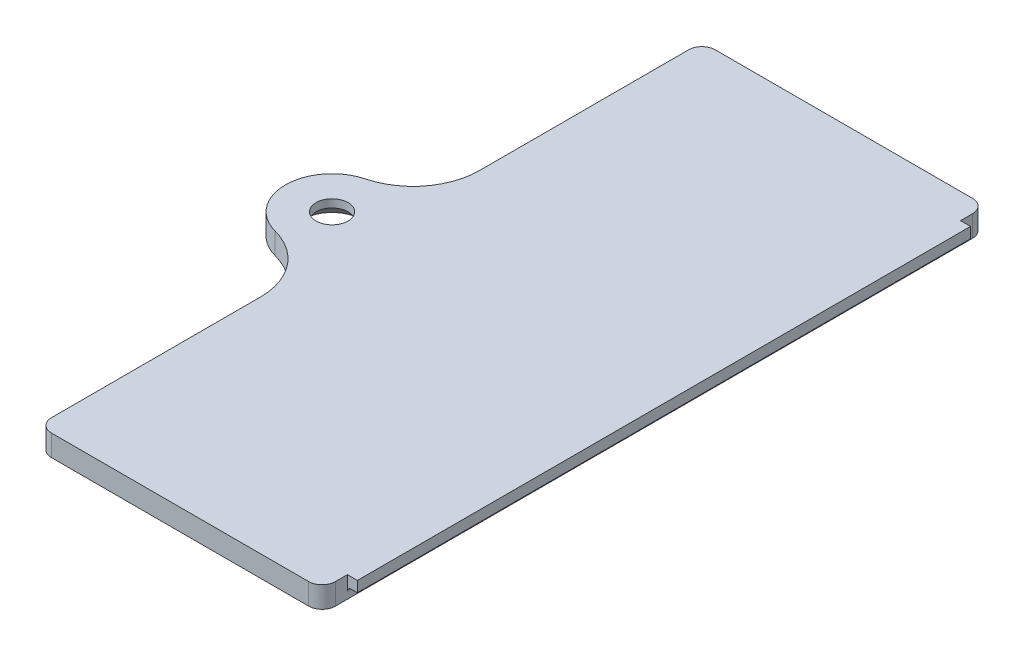
from build123d import *

# Parameters (mm, degrees)
DOOR_PLATE_1_6_SCREW_EAR_R5_R3_5_DEPTH        = 1.6
HOOK_FLANGE_0_75_X_0_8_INNER_FACE_P_2_W       = 0.9
HOOK_FLANGE_0_75_X_0_8_INNER_FACE_P_2_H       = 46
HOOK_FLANGE_0_75_X_0_8_INNER_FACE_PLANE_DEPTH = 0.8
SCREW_HOLE_2_4_FREE_SKETCH_R                  = 1.2
SCREW_HOLE_2_4_FREE_DEPTH                     = 73.114700304
SCREW_CSK_90DEG_M2_SIZE                       = 1
DOOR_CORNERS_R1_PRINT_R                       = 1
HOOK_FLANGE_ROOT_FILLET_R0_3_R                = 0.3
DOOR_TEXT_SLITS_8160749347_PLEASE_RETU_DEPTH  = 0.4
DOOR_TEXT_COUNTER_SLITS_OUTER_FACE_SKE_W      = 2.24
DOOR_TEXT_COUNTER_SLITS_OUTER_FACE_SKE_H      = 1.92
DOOR_TEXT_COUNTER_SLITS_OUTER_FACE_SKE_W_2    = 2.04
DOOR_TEXT_COUNTER_SLITS_OUTER_FACE_SKE_H_2    = 1.72
DOOR_TEXT_COUNTER_SLITS_OUTER_FACE_SKE_W_3    = 5.32
DOOR_TEXT_COUNTER_SLITS_OUTER_FACE_SKE_W_4    = 5.12
DOOR_TEXT_COUNTER_SLITS_OUTER_FACE_SKE_W_5    = 1.24
DOOR_TEXT_COUNTER_SLITS_OUTER_FACE_SKE_H_3    = 1.12
DOOR_TEXT_COUNTER_SLITS_OUTER_FACE_SKE_W_6    = 1.04
DOOR_TEXT_COUNTER_SLITS_OUTER_FACE_SKE_H_4    = 0.92
DOOR_TEXT_COUNTER_SLITS_OUTER_FACE_DEPTH      = 0.4


with BuildPart() as part:
    # Door Plate 1.6 + screw ear (R5 / R3.5) Sketch → Door Plate 1.6 + screw ear (R5 / R3.5) (new body)
    with BuildSketch(Plane(origin=(0, 0, 0), x_dir=(1, 0, 0), z_dir=(0, 1, 0))):
        with BuildLine():
            Line((9.35, 15.1), (30.65, 15.1))
            Line((30.65, 15.1), (30.65, 64.9))
            Line((30.65, 64.9), (9.35, 64.9))
            Line((9.35, 64.9), (9.35, 48.223594105))
            ThreePointArc((9.35, 48.223594105), (8.307494751, 45.167741475), (5.614705882, 43.386185808))
            ThreePointArc((5.614705882, 43.386185808), (3, 40), (5.614705882, 36.613814192))
            ThreePointArc((5.614705882, 36.613814192), (8.307494751, 34.832258525), (9.35, 31.776405895))
            Line((9.35, 31.776405895), (9.35, 15.1))
        make_face()
    extrude(amount=DOOR_PLATE_1_6_SCREW_EAR_R5_R3_5_DEPTH)

    # Hook Flange 0.75 x 0.8 _inner-face p 2 → Hook Flange 0.75 x 0.8 _inner-face plane (add)
    with BuildSketch(Plane(origin=(0, 0.8, 0), x_dir=(1, 0, 0), z_dir=(0, 1, 0))):
        with Locations((30.95, 40)):
            Rectangle(HOOK_FLANGE_0_75_X_0_8_INNER_FACE_P_2_W, HOOK_FLANGE_0_75_X_0_8_INNER_FACE_P_2_H)
    extrude(amount=HOOK_FLANGE_0_75_X_0_8_INNER_FACE_PLANE_DEPTH)

    # Screw Hole 2.4 (free) Sketch → Screw Hole 2.4 (free) (cut, through all)
    with BuildSketch(Plane(origin=(0, 0, 0), x_dir=(1, 0, 0), z_dir=(0, 1, 0))):
        with Locations((6.5, 40)):
            Circle(SCREW_HOLE_2_4_FREE_SKETCH_R)
    extrude(amount=SCREW_HOLE_2_4_FREE_DEPTH, mode=Mode.SUBTRACT)

    # Screw CSK 90deg (M2)
    screw_csk_90deg_m2_edges = [part.edges().sort_by_distance(p)[0] for p in [
        (5.3, 0, -40),
    ]]
    chamfer(screw_csk_90deg_m2_edges, length=SCREW_CSK_90DEG_M2_SIZE)

    # Door Corners R1 (print)
    door_corners_r1_print_edges = [part.edges().sort_by_distance(p)[0] for p in [
        (9.35, 0.8, -64.9),
        (30.65, 0.8, -64.9),
        (30.65, 0.8, -15.1),
        (9.35, 0.8, -15.1),
    ]]
    fillet(door_corners_r1_print_edges, radius=DOOR_CORNERS_R1_PRINT_R)

    # Hook Flange Root Fillet R0.3
    hook_flange_root_fillet_r0_3_edges = [part.edges().sort_by_distance(p)[0] for p in [
        (30.65, 0.8, -40),
    ]]
    fillet(hook_flange_root_fillet_r0_3_edges, radius=HOOK_FLANGE_ROOT_FILLET_R0_3_R)

    # Door Text Slits 8160749347 _ PLEASE  2 → Door Text Slits 8160749347 _ PLEASE RETU (cut)
    # profile 1 of 22: a face of its own
    with BuildSketch(Plane(origin=(0, 0, 0), x_dir=(1, 0, 0), z_dir=(0, 1, 0))):
        with BuildLine():
            Line((27.28, 17.22), (21.12, 17.22))
            ThreePointArc((21.12, 17.22), (20.752304474, 17.372304474), (20.6, 17.74))
            Line((20.6, 17.74), (20.6, 20.5))
            ThreePointArc((20.6, 20.5), (20.752304474, 20.867695526), (21.12, 21.02))
            Line((21.12, 21.02), (27.28, 21.02))
            ThreePointArc((27.28, 21.02), (27.647695526, 20.867695526), (27.8, 20.5))
            Line((27.8, 20.5), (27.8, 17.74))
            ThreePointArc((27.8, 17.74), (27.647695526, 17.372304474), (27.28, 17.22))
        make_face()
        with BuildLine():
            Line((21.12, 17.32), (27.28, 17.32))
            ThreePointArc((27.28, 17.32), (27.576984848, 17.443015152), (27.7, 17.74))
            Line((27.7, 17.74), (27.7, 20.5))
            ThreePointArc((27.7, 20.5), (27.576984848, 20.796984848), (27.28, 20.92))
            Line((27.28, 20.92), (21.12, 20.92))
            ThreePointArc((21.12, 20.92), (20.823015152, 20.796984848), (20.7, 20.5))
            Line((20.7, 20.5), (20.7, 17.74))
            ThreePointArc((20.7, 17.74), (20.823015152, 17.443015152), (21.12, 17.32))
        make_face(mode=Mode.SUBTRACT)
    # profile 2 of 22: a face of its own
    with BuildSketch(Plane(origin=(0, 0, 0), x_dir=(1, 0, 0), z_dir=(0, 1, 0))):
        with BuildLine():
            Line((21.12, 24.28), (27.28, 24.28))
            ThreePointArc((27.28, 24.28), (27.647695526, 24.127695526), (27.8, 23.76))
            Line((27.8, 23.76), (27.8, 22.76))
            ThreePointArc((27.8, 22.76), (27.28, 22.24), (26.76, 22.76))
            Line((26.76, 22.76), (26.76, 23.24))
            Line((26.76, 23.24), (21.12, 23.24))
            ThreePointArc((21.12, 23.24), (20.6, 23.76), (21.12, 24.28))
        make_face()
        with BuildLine():
            Line((27.7, 23.76), (27.7, 22.76))
            ThreePointArc((27.7, 22.76), (27.28, 22.34), (26.86, 22.76))
            Line((26.86, 22.76), (26.86, 23.34))
            Line((26.86, 23.34), (21.12, 23.34))
            ThreePointArc((21.12, 23.34), (20.7, 23.76), (21.12, 24.18))
            Line((21.12, 24.18), (27.28, 24.18))
            ThreePointArc((27.28, 24.18), (27.576984848, 24.056984848), (27.7, 23.76))
        make_face(mode=Mode.SUBTRACT)
    # profile 3 of 22: a face of its own
    with BuildSketch(Plane(origin=(0, 0, 0), x_dir=(1, 0, 0), z_dir=(0, 1, 0))):
        with BuildLine():
            Line((21.12, 30.3), (24.2, 30.3))
            ThreePointArc((24.2, 30.3), (24.567695526, 30.147695526), (24.72, 29.78))
            Line((24.72, 29.78), (24.72, 27.54))
            Line((24.72, 27.54), (26.76, 27.54))
            Line((26.76, 27.54), (26.76, 29.78))
            ThreePointArc((26.76, 29.78), (27.28, 30.3), (27.8, 29.78))
            Line((27.8, 29.78), (27.8, 27.02))
            ThreePointArc((27.8, 27.02), (27.647695526, 26.652304474), (27.28, 26.5))
            Line((27.28, 26.5), (21.12, 26.5))
            ThreePointArc((21.12, 26.5), (20.752304474, 26.652304474), (20.6, 27.02))
            Line((20.6, 27.02), (20.6, 29.78))
            ThreePointArc((20.6, 29.78), (20.752304474, 30.147695526), (21.12, 30.3))
        make_face()
        with BuildLine():
            Line((27.7, 29.78), (27.7, 27.02))
            ThreePointArc((27.7, 27.02), (27.576984848, 26.723015152), (27.28, 26.6))
            Line((27.28, 26.6), (21.12, 26.6))
            ThreePointArc((21.12, 26.6), (20.823015152, 26.723015152), (20.7, 27.02))
            Line((20.7, 27.02), (20.7, 29.78))
            ThreePointArc((20.7, 29.78), (20.823015152, 30.076984848), (21.12, 30.2))
            Line((21.12, 30.2), (24.2, 30.2))
            ThreePointArc((24.2, 30.2), (24.496984848, 30.076984848), (24.62, 29.78))
            Line((24.62, 29.78), (24.62, 27.44))
            Line((24.62, 27.44), (26.86, 27.44))
            Line((26.86, 27.44), (26.86, 29.78))
            ThreePointArc((26.86, 29.78), (27.28, 30.2), (27.7, 29.78))
        make_face(mode=Mode.SUBTRACT)
    # profile 4 of 22: a face of its own
    with BuildSketch(Plane(origin=(0, 0, 0), x_dir=(1, 0, 0), z_dir=(0, 1, 0))):
        with BuildLine():
            Line((27.28, 31.14), (21.12, 31.14))
            ThreePointArc((21.12, 31.14), (20.752304474, 31.292304474), (20.6, 31.66))
            Line((20.6, 31.66), (20.6, 34.42))
            ThreePointArc((20.6, 34.42), (20.752304474, 34.787695526), (21.12, 34.94))
            Line((21.12, 34.94), (27.28, 34.94))
            ThreePointArc((27.28, 34.94), (27.647695526, 34.787695526), (27.8, 34.42))
            Line((27.8, 34.42), (27.8, 31.66))
            ThreePointArc((27.8, 31.66), (27.647695526, 31.292304474), (27.28, 31.14))
        make_face()
        with BuildLine():
            Line((21.12, 31.24), (27.28, 31.24))
            ThreePointArc((27.28, 31.24), (27.576984848, 31.363015152), (27.7, 31.66))
            Line((27.7, 31.66), (27.7, 34.42))
            ThreePointArc((27.7, 34.42), (27.576984848, 34.716984848), (27.28, 34.84))
            Line((27.28, 34.84), (21.12, 34.84))
            ThreePointArc((21.12, 34.84), (20.823015152, 34.716984848), (20.7, 34.42))
            Line((20.7, 34.42), (20.7, 31.66))
            ThreePointArc((20.7, 31.66), (20.823015152, 31.363015152), (21.12, 31.24))
        make_face(mode=Mode.SUBTRACT)
    # profile 5 of 22: a face of its own
    with BuildSketch(Plane(origin=(0, 0, 0), x_dir=(1, 0, 0), z_dir=(0, 1, 0))):
        with BuildLine():
            Line((20.983178949, 37.881677187), (27.143178949, 39.561677187))
            ThreePointArc((27.143178949, 39.561677187), (27.595636701, 39.473247472), (27.8, 39.06))
            Line((27.8, 39.06), (27.8, 36.3))
            ThreePointArc((27.8, 36.3), (27.28, 35.78), (26.76, 36.3))
            Line((26.76, 36.3), (26.76, 38.379189799))
            Line((26.76, 38.379189799), (21.256821051, 36.878322813))
            ThreePointArc((21.256821051, 36.878322813), (20.618322813, 37.243178949), (20.983178949, 37.881677187))
        make_face()
        with BuildLine():
            Line((27.7, 39.06), (27.7, 36.3))
            ThreePointArc((27.7, 36.3), (27.28, 35.88), (26.86, 36.3))
            Line((26.86, 36.3), (26.86, 38.510114838))
            Line((26.86, 38.510114838), (21.23050931, 36.974799195))
            ThreePointArc((21.23050931, 36.974799195), (20.714799195, 37.26949069), (21.00949069, 37.785200805))
            Line((21.00949069, 37.785200805), (27.16949069, 39.465200805))
            ThreePointArc((27.16949069, 39.465200805), (27.534937335, 39.393776804), (27.7, 39.06))
        make_face(mode=Mode.SUBTRACT)
    # profile 6 of 22: a face of its own
    with BuildSketch(Plane(origin=(0, 0, 0), x_dir=(1, 0, 0), z_dir=(0, 1, 0))):
        with BuildLine():
            Line((21.12, 44.22), (27.28, 44.22))
            ThreePointArc((27.28, 44.22), (27.647695526, 44.067695526), (27.8, 43.7))
            ThreePointArc((27.8, 43.7), (27.647695526, 43.332304474), (27.28, 43.18))
            Line((27.28, 43.18), (24.72, 43.18))
            Line((24.72, 43.18), (24.72, 41.46))
            Line((24.72, 41.46), (27.28, 41.46))
            ThreePointArc((27.28, 41.46), (27.647695526, 41.307695526), (27.8, 40.94))
            ThreePointArc((27.8, 40.94), (27.647695526, 40.572304474), (27.28, 40.42))
            Line((27.28, 40.42), (24.2, 40.42))
            ThreePointArc((24.2, 40.42), (23.832304474, 40.572304474), (23.68, 40.94))
            Line((23.68, 40.94), (23.68, 43.18))
            Line((23.68, 43.18), (21.12, 43.18))
            ThreePointArc((21.12, 43.18), (20.6, 43.7), (21.12, 44.22))
        make_face()
        with BuildLine():
            Line((27.28, 40.52), (24.2, 40.52))
            ThreePointArc((24.2, 40.52), (23.903015152, 40.643015152), (23.78, 40.94))
            Line((23.78, 40.94), (23.78, 43.28))
            Line((23.78, 43.28), (21.12, 43.28))
            ThreePointArc((21.12, 43.28), (20.7, 43.7), (21.12, 44.12))
            Line((21.12, 44.12), (27.28, 44.12))
            ThreePointArc((27.28, 44.12), (27.576984848, 43.996984848), (27.7, 43.7))
            ThreePointArc((27.7, 43.7), (27.576984848, 43.403015152), (27.28, 43.28))
            Line((27.28, 43.28), (24.62, 43.28))
            Line((24.62, 43.28), (24.62, 41.36))
            Line((24.62, 41.36), (27.28, 41.36))
            ThreePointArc((27.28, 41.36), (27.576984848, 41.236984848), (27.7, 40.94))
            ThreePointArc((27.7, 40.94), (27.576984848, 40.643015152), (27.28, 40.52))
        make_face(mode=Mode.SUBTRACT)
    # profile 7 of 22: a face of its own
    with BuildSketch(Plane(origin=(0, 0, 0), x_dir=(1, 0, 0), z_dir=(0, 1, 0))):
        with BuildLine():
            Line((23.68, 47.82), (21.64, 47.82))
            Line((21.64, 47.82), (21.64, 45.58))
            ThreePointArc((21.64, 45.58), (21.12, 45.06), (20.6, 45.58))
            Line((20.6, 45.58), (20.6, 48.34))
            ThreePointArc((20.6, 48.34), (20.752304474, 48.707695526), (21.12, 48.86))
            Line((21.12, 48.86), (27.28, 48.86))
            ThreePointArc((27.28, 48.86), (27.647695526, 48.707695526), (27.8, 48.34))
            Line((27.8, 48.34), (27.8, 45.58))
            ThreePointArc((27.8, 45.58), (27.647695526, 45.212304474), (27.28, 45.06))
            Line((27.28, 45.06), (24.2, 45.06))
            ThreePointArc((24.2, 45.06), (23.832304474, 45.212304474), (23.68, 45.58))
            Line((23.68, 45.58), (23.68, 47.82))
        make_face()
        with BuildLine():
            Line((20.7, 48.34), (20.7, 45.58))
            ThreePointArc((20.7, 45.58), (21.12, 45.16), (21.54, 45.58))
            Line((21.54, 45.58), (21.54, 47.92))
            Line((21.54, 47.92), (23.78, 47.92))
            Line((23.78, 47.92), (23.78, 45.58))
            ThreePointArc((23.78, 45.58), (23.903015152, 45.283015152), (24.2, 45.16))
            Line((24.2, 45.16), (27.28, 45.16))
            ThreePointArc((27.28, 45.16), (27.576984848, 45.283015152), (27.7, 45.58))
            Line((27.7, 45.58), (27.7, 48.34))
            ThreePointArc((27.7, 48.34), (27.576984848, 48.636984848), (27.28, 48.76))
            Line((27.28, 48.76), (21.12, 48.76))
            ThreePointArc((21.12, 48.76), (20.823015152, 48.636984848), (20.7, 48.34))
        make_face(mode=Mode.SUBTRACT)
    # profile 8 of 22: a face of its own
    with BuildSketch(Plane(origin=(0, 0, 0), x_dir=(1, 0, 0), z_dir=(0, 1, 0))):
        with BuildLine():
            Line((21.64, 52.46), (21.64, 50.22))
            ThreePointArc((21.64, 50.22), (21.12, 49.7), (20.6, 50.22))
            Line((20.6, 50.22), (20.6, 52.98))
            ThreePointArc((20.6, 52.98), (20.752304474, 53.347695526), (21.12, 53.5))
            Line((21.12, 53.5), (27.28, 53.5))
            ThreePointArc((27.28, 53.5), (27.647695526, 53.347695526), (27.8, 52.98))
            Line((27.8, 52.98), (27.8, 50.22))
            ThreePointArc((27.8, 50.22), (27.28, 49.7), (26.76, 50.22))
            Line((26.76, 50.22), (26.76, 52.46))
            Line((26.76, 52.46), (24.72, 52.46))
            Line((24.72, 52.46), (24.72, 51.02))
            ThreePointArc((24.72, 51.02), (24.2, 50.5), (23.68, 51.02))
            Line((23.68, 51.02), (23.68, 52.46))
            Line((23.68, 52.46), (21.64, 52.46))
        make_face()
        with BuildLine():
            Line((27.28, 53.4), (21.12, 53.4))
            ThreePointArc((21.12, 53.4), (20.823015152, 53.276984848), (20.7, 52.98))
            Line((20.7, 52.98), (20.7, 50.22))
            ThreePointArc((20.7, 50.22), (21.12, 49.8), (21.54, 50.22))
            Line((21.54, 50.22), (21.54, 52.56))
            Line((21.54, 52.56), (23.78, 52.56))
            Line((23.78, 52.56), (23.78, 51.02))
            ThreePointArc((23.78, 51.02), (24.2, 50.6), (24.62, 51.02))
            Line((24.62, 51.02), (24.62, 52.56))
            Line((24.62, 52.56), (26.86, 52.56))
            Line((26.86, 52.56), (26.86, 50.22))
            ThreePointArc((26.86, 50.22), (27.28, 49.8), (27.7, 50.22))
            Line((27.7, 50.22), (27.7, 52.98))
            ThreePointArc((27.7, 52.98), (27.576984848, 53.276984848), (27.28, 53.4))
        make_face(mode=Mode.SUBTRACT)
    # profile 9 of 22: a face of its own
    with BuildSketch(Plane(origin=(0, 0, 0), x_dir=(1, 0, 0), z_dir=(0, 1, 0))):
        with BuildLine():
            Line((21.12, 58.14), (27.28, 58.14))
            ThreePointArc((27.28, 58.14), (27.647695526, 57.987695526), (27.8, 57.62))
            ThreePointArc((27.8, 57.62), (27.647695526, 57.252304474), (27.28, 57.1))
            Line((27.28, 57.1), (24.72, 57.1))
            Line((24.72, 57.1), (24.72, 55.38))
            Line((24.72, 55.38), (27.28, 55.38))
            ThreePointArc((27.28, 55.38), (27.647695526, 55.227695526), (27.8, 54.86))
            ThreePointArc((27.8, 54.86), (27.647695526, 54.492304474), (27.28, 54.34))
            Line((27.28, 54.34), (24.2, 54.34))
            ThreePointArc((24.2, 54.34), (23.832304474, 54.492304474), (23.68, 54.86))
            Line((23.68, 54.86), (23.68, 57.1))
            Line((23.68, 57.1), (21.12, 57.1))
            ThreePointArc((21.12, 57.1), (20.6, 57.62), (21.12, 58.14))
        make_face()
        with BuildLine():
            Line((27.28, 54.44), (24.2, 54.44))
            ThreePointArc((24.2, 54.44), (23.903015152, 54.563015152), (23.78, 54.86))
            Line((23.78, 54.86), (23.78, 57.2))
            Line((23.78, 57.2), (21.12, 57.2))
            ThreePointArc((21.12, 57.2), (20.7, 57.62), (21.12, 58.04))
            Line((21.12, 58.04), (27.28, 58.04))
            ThreePointArc((27.28, 58.04), (27.576984848, 57.916984848), (27.7, 57.62))
            ThreePointArc((27.7, 57.62), (27.576984848, 57.323015152), (27.28, 57.2))
            Line((27.28, 57.2), (24.62, 57.2))
            Line((24.62, 57.2), (24.62, 55.28))
            Line((24.62, 55.28), (27.28, 55.28))
            ThreePointArc((27.28, 55.28), (27.576984848, 55.156984848), (27.7, 54.86))
            ThreePointArc((27.7, 54.86), (27.576984848, 54.563015152), (27.28, 54.44))
        make_face(mode=Mode.SUBTRACT)
    # profile 10 of 22: a face of its own
    with BuildSketch(Plane(origin=(0, 0, 0), x_dir=(1, 0, 0), z_dir=(0, 1, 0))):
        with BuildLine():
            Line((20.983178949, 61.081677187), (27.143178949, 62.761677187))
            ThreePointArc((27.143178949, 62.761677187), (27.595636701, 62.673247472), (27.8, 62.26))
            Line((27.8, 62.26), (27.8, 59.5))
            ThreePointArc((27.8, 59.5), (27.28, 58.98), (26.76, 59.5))
            Line((26.76, 59.5), (26.76, 61.579189799))
            Line((26.76, 61.579189799), (21.256821051, 60.078322813))
            ThreePointArc((21.256821051, 60.078322813), (20.618322813, 60.443178949), (20.983178949, 61.081677187))
        make_face()
        with BuildLine():
            Line((27.7, 62.26), (27.7, 59.5))
            ThreePointArc((27.7, 59.5), (27.28, 59.08), (26.86, 59.5))
            Line((26.86, 59.5), (26.86, 61.710114838))
            Line((26.86, 61.710114838), (21.23050931, 60.174799195))
            ThreePointArc((21.23050931, 60.174799195), (20.714799195, 60.46949069), (21.00949069, 60.985200805))
            Line((21.00949069, 60.985200805), (27.16949069, 62.665200805))
            ThreePointArc((27.16949069, 62.665200805), (27.534937335, 62.593776804), (27.7, 62.26))
        make_face(mode=Mode.SUBTRACT)
    # profile 11 of 22: a face of its own
    with BuildSketch(Plane(origin=(0, 0, 0), x_dir=(1, 0, 0), z_dir=(0, 1, 0))):
        with BuildLine():
            Line((18.28, 19.76), (16.2, 19.76))
            ThreePointArc((16.2, 19.76), (15.832304474, 19.607695526), (15.68, 19.24))
            Line((15.68, 19.24), (15.68, 17.8))
            Line((15.68, 17.8), (14.12, 17.8))
            ThreePointArc((14.12, 17.8), (13.6, 17.28), (14.12, 16.76))
            Line((14.12, 16.76), (18.28, 16.76))
            ThreePointArc((18.28, 16.76), (18.647695526, 16.912304474), (18.8, 17.28))
            Line((18.8, 17.28), (18.8, 19.24))
            ThreePointArc((18.8, 19.24), (18.647695526, 19.607695526), (18.28, 19.76))
        make_face()
        with BuildLine():
            Line((14.12, 16.86), (18.28, 16.86))
            ThreePointArc((18.28, 16.86), (18.576984848, 16.983015152), (18.7, 17.28))
            Line((18.7, 17.28), (18.7, 19.24))
            ThreePointArc((18.7, 19.24), (18.576984848, 19.536984848), (18.28, 19.66))
            Line((18.28, 19.66), (16.2, 19.66))
            ThreePointArc((16.2, 19.66), (15.903015152, 19.536984848), (15.78, 19.24))
            Line((15.78, 19.24), (15.78, 17.7))
            Line((15.78, 17.7), (14.12, 17.7))
            ThreePointArc((14.12, 17.7), (13.7, 17.28), (14.12, 16.86))
        make_face(mode=Mode.SUBTRACT)
    # profile 12 of 22: a face of its own
    with BuildSketch(Plane(origin=(0, 0, 0), x_dir=(1, 0, 0), z_dir=(0, 1, 0))):
        with BuildLine():
            Line((13.6, 21.12), (13.6, 22.48))
            ThreePointArc((13.6, 22.48), (14.12, 23), (14.64, 22.48))
            Line((14.64, 22.48), (14.64, 21.64))
            Line((14.64, 21.64), (18.28, 21.64))
            ThreePointArc((18.28, 21.64), (18.647695526, 21.487695526), (18.8, 21.12))
            ThreePointArc((18.8, 21.12), (18.647695526, 20.752304474), (18.28, 20.6))
            Line((18.28, 20.6), (14.12, 20.6))
            ThreePointArc((14.12, 20.6), (13.752304474, 20.752304474), (13.6, 21.12))
        make_face()
        with BuildLine():
            Line((14.54, 21.54), (18.28, 21.54))
            ThreePointArc((18.28, 21.54), (18.576984848, 21.416984848), (18.7, 21.12))
            ThreePointArc((18.7, 21.12), (18.576984848, 20.823015152), (18.28, 20.7))
            Line((18.28, 20.7), (14.12, 20.7))
            ThreePointArc((14.12, 20.7), (13.823015152, 20.823015152), (13.7, 21.12))
            Line((13.7, 21.12), (13.7, 22.48))
            ThreePointArc((13.7, 22.48), (14.12, 22.9), (14.54, 22.48))
            Line((14.54, 22.48), (14.54, 21.54))
        make_face(mode=Mode.SUBTRACT)
    # profile 13 of 22: a face of its own
    with BuildSketch(Plane(origin=(0, 0, 0), x_dir=(1, 0, 0), z_dir=(0, 1, 0))):
        with BuildLine():
            Line((14.64, 25.72), (14.64, 24.88))
            Line((14.64, 24.88), (15.68, 24.88))
            Line((15.68, 24.88), (15.68, 25.42))
            ThreePointArc((15.68, 25.42), (16.2, 25.94), (16.72, 25.42))
            Line((16.72, 25.42), (16.72, 24.88))
            Line((16.72, 24.88), (17.76, 24.88))
            Line((17.76, 24.88), (17.76, 25.72))
            ThreePointArc((17.76, 25.72), (18.28, 26.24), (18.8, 25.72))
            Line((18.8, 25.72), (18.8, 24.36))
            ThreePointArc((18.8, 24.36), (18.647695526, 23.992304474), (18.28, 23.84))
            Line((18.28, 23.84), (14.12, 23.84))
            ThreePointArc((14.12, 23.84), (13.752304474, 23.992304474), (13.6, 24.36))
            Line((13.6, 24.36), (13.6, 25.72))
            ThreePointArc((13.6, 25.72), (14.12, 26.24), (14.64, 25.72))
        make_face()
        with BuildLine():
            Line((18.7, 25.72), (18.7, 24.36))
            ThreePointArc((18.7, 24.36), (18.576984848, 24.063015152), (18.28, 23.94))
            Line((18.28, 23.94), (14.12, 23.94))
            ThreePointArc((14.12, 23.94), (13.823015152, 24.063015152), (13.7, 24.36))
            Line((13.7, 24.36), (13.7, 25.72))
            ThreePointArc((13.7, 25.72), (14.12, 26.14), (14.54, 25.72))
            Line((14.54, 25.72), (14.54, 24.78))
            Line((14.54, 24.78), (15.78, 24.78))
            Line((15.78, 24.78), (15.78, 25.42))
            ThreePointArc((15.78, 25.42), (16.2, 25.84), (16.62, 25.42))
            Line((16.62, 25.42), (16.62, 24.78))
            Line((16.62, 24.78), (17.86, 24.78))
            Line((17.86, 24.78), (17.86, 25.72))
            ThreePointArc((17.86, 25.72), (18.28, 26.14), (18.7, 25.72))
        make_face(mode=Mode.SUBTRACT)
    # profile 14 of 22: a face of its own
    with BuildSketch(Plane(origin=(0, 0, 0), x_dir=(1, 0, 0), z_dir=(0, 1, 0))):
        with BuildLine():
            Line((14.12, 29.04), (15.68, 29.04))
            Line((15.68, 29.04), (15.68, 28.12))
            Line((15.68, 28.12), (14.12, 28.12))
            ThreePointArc((14.12, 28.12), (13.6, 27.6), (14.12, 27.08))
            Line((14.12, 27.08), (18.28, 27.08))
            ThreePointArc((18.28, 27.08), (18.647695526, 27.232304474), (18.8, 27.6))
            Line((18.8, 27.6), (18.8, 29.56))
            ThreePointArc((18.8, 29.56), (18.647695526, 29.927695526), (18.28, 30.08))
            Line((18.28, 30.08), (14.12, 30.08))
            ThreePointArc((14.12, 30.08), (13.6, 29.56), (14.12, 29.04))
        make_face()
        with BuildLine():
            Line((14.12, 27.18), (18.28, 27.18))
            ThreePointArc((18.28, 27.18), (18.576984848, 27.303015152), (18.7, 27.6))
            Line((18.7, 27.6), (18.7, 29.56))
            ThreePointArc((18.7, 29.56), (18.576984848, 29.856984848), (18.28, 29.98))
            Line((18.28, 29.98), (14.12, 29.98))
            ThreePointArc((14.12, 29.98), (13.7, 29.56), (14.12, 29.14))
            Line((14.12, 29.14), (15.78, 29.14))
            Line((15.78, 29.14), (15.78, 28.02))
            Line((15.78, 28.02), (14.12, 28.02))
            ThreePointArc((14.12, 28.02), (13.7, 27.6), (14.12, 27.18))
        make_face(mode=Mode.SUBTRACT)
    # profile 15 of 22: a face of its own
    with BuildSketch(Plane(origin=(0, 0, 0), x_dir=(1, 0, 0), z_dir=(0, 1, 0))):
        with BuildLine():
            Line((13.6, 31.44), (13.6, 33.2))
            ThreePointArc((13.6, 33.2), (13.752304474, 33.567695526), (14.12, 33.72))
            Line((14.12, 33.72), (16.2, 33.72))
            ThreePointArc((16.2, 33.72), (16.567695526, 33.567695526), (16.72, 33.2))
            Line((16.72, 33.2), (16.72, 31.96))
            Line((16.72, 31.96), (17.76, 31.96))
            Line((17.76, 31.96), (17.76, 33.2))
            ThreePointArc((17.76, 33.2), (18.28, 33.72), (18.8, 33.2))
            Line((18.8, 33.2), (18.8, 31.44))
            ThreePointArc((18.8, 31.44), (18.647695526, 31.072304474), (18.28, 30.92))
            Line((18.28, 30.92), (16.2, 30.92))
            ThreePointArc((16.2, 30.92), (15.832304474, 31.072304474), (15.68, 31.44))
            Line((15.68, 31.44), (15.68, 32.68))
            Line((15.68, 32.68), (14.64, 32.68))
            Line((14.64, 32.68), (14.64, 31.44))
            ThreePointArc((14.64, 31.44), (14.12, 30.92), (13.6, 31.44))
        make_face()
        with BuildLine():
            Line((17.86, 31.86), (17.86, 33.2))
            ThreePointArc((17.86, 33.2), (18.28, 33.62), (18.7, 33.2))
            Line((18.7, 33.2), (18.7, 31.44))
            ThreePointArc((18.7, 31.44), (18.576984848, 31.143015152), (18.28, 31.02))
            Line((18.28, 31.02), (16.2, 31.02))
            ThreePointArc((16.2, 31.02), (15.903015152, 31.143015152), (15.78, 31.44))
            Line((15.78, 31.44), (15.78, 32.78))
            Line((15.78, 32.78), (14.54, 32.78))
            Line((14.54, 32.78), (14.54, 31.44))
            ThreePointArc((14.54, 31.44), (14.12, 31.02), (13.7, 31.44))
            Line((13.7, 31.44), (13.7, 33.2))
            ThreePointArc((13.7, 33.2), (13.823015152, 33.496984848), (14.12, 33.62))
            Line((14.12, 33.62), (16.2, 33.62))
            ThreePointArc((16.2, 33.62), (16.496984848, 33.496984848), (16.62, 33.2))
            Line((16.62, 33.2), (16.62, 31.86))
            Line((16.62, 31.86), (17.86, 31.86))
        make_face(mode=Mode.SUBTRACT)
    # profile 16 of 22: a face of its own
    with BuildSketch(Plane(origin=(0, 0, 0), x_dir=(1, 0, 0), z_dir=(0, 1, 0))):
        with BuildLine():
            Line((14.64, 36.44), (14.64, 35.6))
            Line((14.64, 35.6), (15.68, 35.6))
            Line((15.68, 35.6), (15.68, 36.14))
            ThreePointArc((15.68, 36.14), (16.2, 36.66), (16.72, 36.14))
            Line((16.72, 36.14), (16.72, 35.6))
            Line((16.72, 35.6), (17.76, 35.6))
            Line((17.76, 35.6), (17.76, 36.44))
            ThreePointArc((17.76, 36.44), (18.28, 36.96), (18.8, 36.44))
            Line((18.8, 36.44), (18.8, 35.08))
            ThreePointArc((18.8, 35.08), (18.647695526, 34.712304474), (18.28, 34.56))
            Line((18.28, 34.56), (14.12, 34.56))
            ThreePointArc((14.12, 34.56), (13.752304474, 34.712304474), (13.6, 35.08))
            Line((13.6, 35.08), (13.6, 36.44))
            ThreePointArc((13.6, 36.44), (14.12, 36.96), (14.64, 36.44))
        make_face()
        with BuildLine():
            Line((18.7, 36.44), (18.7, 35.08))
            ThreePointArc((18.7, 35.08), (18.576984848, 34.783015152), (18.28, 34.66))
            Line((18.28, 34.66), (14.12, 34.66))
            ThreePointArc((14.12, 34.66), (13.823015152, 34.783015152), (13.7, 35.08))
            Line((13.7, 35.08), (13.7, 36.44))
            ThreePointArc((13.7, 36.44), (14.12, 36.86), (14.54, 36.44))
            Line((14.54, 36.44), (14.54, 35.5))
            Line((14.54, 35.5), (15.78, 35.5))
            Line((15.78, 35.5), (15.78, 36.14))
            ThreePointArc((15.78, 36.14), (16.2, 36.56), (16.62, 36.14))
            Line((16.62, 36.14), (16.62, 35.5))
            Line((16.62, 35.5), (17.86, 35.5))
            Line((17.86, 35.5), (17.86, 36.44))
            ThreePointArc((17.86, 36.44), (18.28, 36.86), (18.7, 36.44))
        make_face(mode=Mode.SUBTRACT)
    # profile 17 of 22: a face of its own
    with BuildSketch(Plane(origin=(0, 0, 0), x_dir=(1, 0, 0), z_dir=(0, 1, 0))):
        with BuildLine():
            Line((15.68, 43.52), (15.68, 43.424623769))
            Line((15.68, 43.424623769), (14.322612795, 43.998902971))
            ThreePointArc((14.322612795, 43.998902971), (13.641097029, 43.722612795), (13.917387205, 43.041097029))
            Line((13.917387205, 43.041097029), (15.68, 42.295376231))
            Line((15.68, 42.295376231), (15.68, 41.28))
            Line((15.68, 41.28), (14.12, 41.28))
            ThreePointArc((14.12, 41.28), (13.6, 40.76), (14.12, 40.24))
            Line((14.12, 40.24), (18.28, 40.24))
            ThreePointArc((18.28, 40.24), (18.647695526, 40.392304474), (18.8, 40.76))
            Line((18.8, 40.76), (18.8, 43.52))
            ThreePointArc((18.8, 43.52), (18.647695526, 43.887695526), (18.28, 44.04))
            Line((18.28, 44.04), (16.2, 44.04))
            ThreePointArc((16.2, 44.04), (15.832304474, 43.887695526), (15.68, 43.52))
        make_face()
        with BuildLine():
            Line((14.12, 40.34), (18.28, 40.34))
            ThreePointArc((18.28, 40.34), (18.576984848, 40.463015152), (18.7, 40.76))
            Line((18.7, 40.76), (18.7, 43.52))
            ThreePointArc((18.7, 43.52), (18.576984848, 43.816984848), (18.28, 43.94))
            Line((18.28, 43.94), (16.2, 43.94))
            ThreePointArc((16.2, 43.94), (15.903015152, 43.816984848), (15.78, 43.52))
            Line((15.78, 43.52), (15.78, 43.273734582))
            Line((15.78, 43.273734582), (14.283648796, 43.906806245))
            ThreePointArc((14.283648796, 43.906806245), (13.733193755, 43.683648796), (13.956351204, 43.133193755))
            Line((13.956351204, 43.133193755), (15.78, 42.361650033))
            Line((15.78, 42.361650033), (15.78, 41.18))
            Line((15.78, 41.18), (14.12, 41.18))
            ThreePointArc((14.12, 41.18), (13.7, 40.76), (14.12, 40.34))
        make_face(mode=Mode.SUBTRACT)
    # profile 18 of 22: a face of its own
    with BuildSketch(Plane(origin=(0, 0, 0), x_dir=(1, 0, 0), z_dir=(0, 1, 0))):
        with BuildLine():
            Line((14.64, 46.76), (14.64, 45.92))
            Line((14.64, 45.92), (15.68, 45.92))
            Line((15.68, 45.92), (15.68, 46.46))
            ThreePointArc((15.68, 46.46), (16.2, 46.98), (16.72, 46.46))
            Line((16.72, 46.46), (16.72, 45.92))
            Line((16.72, 45.92), (17.76, 45.92))
            Line((17.76, 45.92), (17.76, 46.76))
            ThreePointArc((17.76, 46.76), (18.28, 47.28), (18.8, 46.76))
            Line((18.8, 46.76), (18.8, 45.4))
            ThreePointArc((18.8, 45.4), (18.647695526, 45.032304474), (18.28, 44.88))
            Line((18.28, 44.88), (14.12, 44.88))
            ThreePointArc((14.12, 44.88), (13.752304474, 45.032304474), (13.6, 45.4))
            Line((13.6, 45.4), (13.6, 46.76))
            ThreePointArc((13.6, 46.76), (14.12, 47.28), (14.64, 46.76))
        make_face()
        with BuildLine():
            Line((18.7, 46.76), (18.7, 45.4))
            ThreePointArc((18.7, 45.4), (18.576984848, 45.103015152), (18.28, 44.98))
            Line((18.28, 44.98), (14.12, 44.98))
            ThreePointArc((14.12, 44.98), (13.823015152, 45.103015152), (13.7, 45.4))
            Line((13.7, 45.4), (13.7, 46.76))
            ThreePointArc((13.7, 46.76), (14.12, 47.18), (14.54, 46.76))
            Line((14.54, 46.76), (14.54, 45.82))
            Line((14.54, 45.82), (15.78, 45.82))
            Line((15.78, 45.82), (15.78, 46.46))
            ThreePointArc((15.78, 46.46), (16.2, 46.88), (16.62, 46.46))
            Line((16.62, 46.46), (16.62, 45.82))
            Line((16.62, 45.82), (17.86, 45.82))
            Line((17.86, 45.82), (17.86, 46.76))
            ThreePointArc((17.86, 46.76), (18.28, 47.18), (18.7, 46.76))
        make_face(mode=Mode.SUBTRACT)
    # profile 19 of 22: a face of its own
    with BuildSketch(Plane(origin=(0, 0, 0), x_dir=(1, 0, 0), z_dir=(0, 1, 0))):
        with BuildLine():
            Line((14.12, 49), (17.76, 49))
            Line((17.76, 49), (17.76, 48.64))
            ThreePointArc((17.76, 48.64), (18.28, 48.12), (18.8, 48.64))
            Line((18.8, 48.64), (18.8, 50.4))
            ThreePointArc((18.8, 50.4), (18.28, 50.92), (17.76, 50.4))
            Line((17.76, 50.4), (17.76, 50.04))
            Line((17.76, 50.04), (14.12, 50.04))
            ThreePointArc((14.12, 50.04), (13.6, 49.52), (14.12, 49))
        make_face()
        with BuildLine():
            Line((18.7, 48.64), (18.7, 50.4))
            ThreePointArc((18.7, 50.4), (18.28, 50.82), (17.86, 50.4))
            Line((17.86, 50.4), (17.86, 49.94))
            Line((17.86, 49.94), (14.12, 49.94))
            ThreePointArc((14.12, 49.94), (13.7, 49.52), (14.12, 49.1))
            Line((14.12, 49.1), (17.86, 49.1))
            Line((17.86, 49.1), (17.86, 48.64))
            ThreePointArc((17.86, 48.64), (18.28, 48.22), (18.7, 48.64))
        make_face(mode=Mode.SUBTRACT)
    # profile 20 of 22: a face of its own
    with BuildSketch(Plane(origin=(0, 0, 0), x_dir=(1, 0, 0), z_dir=(0, 1, 0))):
        with BuildLine():
            Line((14.12, 54.76), (18.28, 54.76))
            ThreePointArc((18.28, 54.76), (18.647695526, 54.607695526), (18.8, 54.24))
            ThreePointArc((18.8, 54.24), (18.647695526, 53.872304474), (18.28, 53.72))
            Line((18.28, 53.72), (14.64, 53.72))
            Line((14.64, 53.72), (14.64, 52.8))
            Line((14.64, 52.8), (18.28, 52.8))
            ThreePointArc((18.28, 52.8), (18.647695526, 52.647695526), (18.8, 52.28))
            ThreePointArc((18.8, 52.28), (18.647695526, 51.912304474), (18.28, 51.76))
            Line((18.28, 51.76), (14.12, 51.76))
            ThreePointArc((14.12, 51.76), (13.752304474, 51.912304474), (13.6, 52.28))
            Line((13.6, 52.28), (13.6, 54.24))
            ThreePointArc((13.6, 54.24), (13.752304474, 54.607695526), (14.12, 54.76))
        make_face()
        with BuildLine():
            Line((14.54, 52.7), (18.28, 52.7))
            ThreePointArc((18.28, 52.7), (18.576984848, 52.576984848), (18.7, 52.28))
            ThreePointArc((18.7, 52.28), (18.576984848, 51.983015152), (18.28, 51.86))
            Line((18.28, 51.86), (14.12, 51.86))
            ThreePointArc((14.12, 51.86), (13.823015152, 51.983015152), (13.7, 52.28))
            Line((13.7, 52.28), (13.7, 54.24))
            ThreePointArc((13.7, 54.24), (13.823015152, 54.536984848), (14.12, 54.66))
            Line((14.12, 54.66), (18.28, 54.66))
            ThreePointArc((18.28, 54.66), (18.576984848, 54.536984848), (18.7, 54.24))
            ThreePointArc((18.7, 54.24), (18.576984848, 53.943015152), (18.28, 53.82))
            Line((18.28, 53.82), (14.54, 53.82))
            Line((14.54, 53.82), (14.54, 52.7))
        make_face(mode=Mode.SUBTRACT)
    # profile 21 of 22: a face of its own
    with BuildSketch(Plane(origin=(0, 0, 0), x_dir=(1, 0, 0), z_dir=(0, 1, 0))):
        with BuildLine():
            Line((15.68, 58.88), (15.68, 58.784623769))
            Line((15.68, 58.784623769), (14.322612795, 59.358902971))
            ThreePointArc((14.322612795, 59.358902971), (13.641097029, 59.082612795), (13.917387205, 58.401097029))
            Line((13.917387205, 58.401097029), (15.68, 57.655376231))
            Line((15.68, 57.655376231), (15.68, 56.64))
            Line((15.68, 56.64), (14.12, 56.64))
            ThreePointArc((14.12, 56.64), (13.6, 56.12), (14.12, 55.6))
            Line((14.12, 55.6), (18.28, 55.6))
            ThreePointArc((18.28, 55.6), (18.647695526, 55.752304474), (18.8, 56.12))
            Line((18.8, 56.12), (18.8, 58.88))
            ThreePointArc((18.8, 58.88), (18.647695526, 59.247695526), (18.28, 59.4))
            Line((18.28, 59.4), (16.2, 59.4))
            ThreePointArc((16.2, 59.4), (15.832304474, 59.247695526), (15.68, 58.88))
        make_face()
        with BuildLine():
            Line((14.12, 55.7), (18.28, 55.7))
            ThreePointArc((18.28, 55.7), (18.576984848, 55.823015152), (18.7, 56.12))
            Line((18.7, 56.12), (18.7, 58.88))
            ThreePointArc((18.7, 58.88), (18.576984848, 59.176984848), (18.28, 59.3))
            Line((18.28, 59.3), (16.2, 59.3))
            ThreePointArc((16.2, 59.3), (15.903015152, 59.176984848), (15.78, 58.88))
            Line((15.78, 58.88), (15.78, 58.633734582))
            Line((15.78, 58.633734582), (14.283648796, 59.266806245))
            ThreePointArc((14.283648796, 59.266806245), (13.733193755, 59.043648796), (13.956351204, 58.493193755))
            Line((13.956351204, 58.493193755), (15.78, 57.721650033))
            Line((15.78, 57.721650033), (15.78, 56.54))
            Line((15.78, 56.54), (14.12, 56.54))
            ThreePointArc((14.12, 56.54), (13.7, 56.12), (14.12, 55.7))
        make_face(mode=Mode.SUBTRACT)
    # profile 22 of 22: a face of its own
    with BuildSketch(Plane(origin=(0, 0, 0), x_dir=(1, 0, 0), z_dir=(0, 1, 0))):
        with BuildLine():
            Line((14.12, 63.24), (18.28, 63.24))
            ThreePointArc((18.28, 63.24), (18.647695526, 63.087695526), (18.8, 62.72))
            Line((18.8, 62.72), (18.8, 60.76))
            ThreePointArc((18.8, 60.76), (18.647695526, 60.392304474), (18.28, 60.24))
            Line((18.28, 60.24), (14.12, 60.24))
            ThreePointArc((14.12, 60.24), (13.6, 60.76), (14.12, 61.28))
            Line((14.12, 61.28), (17.76, 61.28))
            Line((17.76, 61.28), (17.76, 62.2))
            Line((17.76, 62.2), (14.12, 62.2))
            ThreePointArc((14.12, 62.2), (13.6, 62.72), (14.12, 63.24))
        make_face()
        with BuildLine():
            Line((18.28, 60.34), (14.12, 60.34))
            ThreePointArc((14.12, 60.34), (13.7, 60.76), (14.12, 61.18))
            Line((14.12, 61.18), (17.86, 61.18))
            Line((17.86, 61.18), (17.86, 62.3))
            Line((17.86, 62.3), (14.12, 62.3))
            ThreePointArc((14.12, 62.3), (13.7, 62.72), (14.12, 63.14))
            Line((14.12, 63.14), (18.28, 63.14))
            ThreePointArc((18.28, 63.14), (18.576984848, 63.016984848), (18.7, 62.72))
            Line((18.7, 62.72), (18.7, 60.76))
            ThreePointArc((18.7, 60.76), (18.576984848, 60.463015152), (18.28, 60.34))
        make_face(mode=Mode.SUBTRACT)
    extrude(amount=DOOR_TEXT_SLITS_8160749347_PLEASE_RETU_DEPTH, mode=Mode.SUBTRACT)

    # Door Text Counter Slits (outer face) Sketch → Door Text Counter Slits (outer face) (cut)
    # profile 1 of 9: a face of its own
    with BuildSketch(Plane(origin=(0, 0, 0), x_dir=(1, 0, 0), z_dir=(0, 1, 0))):
        with Locations((25.74, 19.12)):
            Rectangle(DOOR_TEXT_COUNTER_SLITS_OUTER_FACE_SKE_W, DOOR_TEXT_COUNTER_SLITS_OUTER_FACE_SKE_H)
        with Locations((25.74, 19.12)):
            Rectangle(DOOR_TEXT_COUNTER_SLITS_OUTER_FACE_SKE_W_2, DOOR_TEXT_COUNTER_SLITS_OUTER_FACE_SKE_H_2, mode=Mode.SUBTRACT)
    # profile 2 of 9: a face of its own
    with BuildSketch(Plane(origin=(0, 0, 0), x_dir=(1, 0, 0), z_dir=(0, 1, 0))):
        with Locations((22.66, 19.12)):
            Rectangle(DOOR_TEXT_COUNTER_SLITS_OUTER_FACE_SKE_W, DOOR_TEXT_COUNTER_SLITS_OUTER_FACE_SKE_H)
        with Locations((22.66, 19.12)):
            Rectangle(DOOR_TEXT_COUNTER_SLITS_OUTER_FACE_SKE_W_2, DOOR_TEXT_COUNTER_SLITS_OUTER_FACE_SKE_H_2, mode=Mode.SUBTRACT)
    # profile 3 of 9: a face of its own
    with BuildSketch(Plane(origin=(0, 0, 0), x_dir=(1, 0, 0), z_dir=(0, 1, 0))):
        with Locations((22.66, 28.4)):
            Rectangle(DOOR_TEXT_COUNTER_SLITS_OUTER_FACE_SKE_W, DOOR_TEXT_COUNTER_SLITS_OUTER_FACE_SKE_H)
        with Locations((22.66, 28.4)):
            Rectangle(DOOR_TEXT_COUNTER_SLITS_OUTER_FACE_SKE_W_2, DOOR_TEXT_COUNTER_SLITS_OUTER_FACE_SKE_H_2, mode=Mode.SUBTRACT)
    # profile 4 of 9: a face of its own
    with BuildSketch(Plane(origin=(0, 0, 0), x_dir=(1, 0, 0), z_dir=(0, 1, 0))):
        with Locations((24.2, 33.04)):
            Rectangle(DOOR_TEXT_COUNTER_SLITS_OUTER_FACE_SKE_W_3, DOOR_TEXT_COUNTER_SLITS_OUTER_FACE_SKE_H)
        with Locations((24.2, 33.04)):
            Rectangle(DOOR_TEXT_COUNTER_SLITS_OUTER_FACE_SKE_W_4, DOOR_TEXT_COUNTER_SLITS_OUTER_FACE_SKE_H_2, mode=Mode.SUBTRACT)
    # profile 5 of 9: a face of its own
    with BuildSketch(Plane(origin=(0, 0, 0), x_dir=(1, 0, 0), z_dir=(0, 1, 0))):
        with Locations((25.74, 46.96)):
            Rectangle(DOOR_TEXT_COUNTER_SLITS_OUTER_FACE_SKE_W, DOOR_TEXT_COUNTER_SLITS_OUTER_FACE_SKE_H)
        with Locations((25.74, 46.96)):
            Rectangle(DOOR_TEXT_COUNTER_SLITS_OUTER_FACE_SKE_W_2, DOOR_TEXT_COUNTER_SLITS_OUTER_FACE_SKE_H_2, mode=Mode.SUBTRACT)
    # profile 6 of 9: a face of its own
    with BuildSketch(Plane(origin=(0, 0, 0), x_dir=(1, 0, 0), z_dir=(0, 1, 0))):
        with Locations((17.24, 18.26)):
            Rectangle(DOOR_TEXT_COUNTER_SLITS_OUTER_FACE_SKE_W_5, DOOR_TEXT_COUNTER_SLITS_OUTER_FACE_SKE_H_3)
        with Locations((17.24, 18.26)):
            Rectangle(DOOR_TEXT_COUNTER_SLITS_OUTER_FACE_SKE_W_6, DOOR_TEXT_COUNTER_SLITS_OUTER_FACE_SKE_H_4, mode=Mode.SUBTRACT)
    # profile 7 of 9: a face of its own
    with BuildSketch(Plane(origin=(0, 0, 0), x_dir=(1, 0, 0), z_dir=(0, 1, 0))):
        with Locations((17.24, 28.58)):
            Rectangle(DOOR_TEXT_COUNTER_SLITS_OUTER_FACE_SKE_W_5, DOOR_TEXT_COUNTER_SLITS_OUTER_FACE_SKE_H_3)
        with Locations((17.24, 28.58)):
            Rectangle(DOOR_TEXT_COUNTER_SLITS_OUTER_FACE_SKE_W_6, DOOR_TEXT_COUNTER_SLITS_OUTER_FACE_SKE_H_4, mode=Mode.SUBTRACT)
    # profile 8 of 9: a face of its own
    with BuildSketch(Plane(origin=(0, 0, 0), x_dir=(1, 0, 0), z_dir=(0, 1, 0))):
        with Locations((17.24, 42.14)):
            Rectangle(DOOR_TEXT_COUNTER_SLITS_OUTER_FACE_SKE_W_5, DOOR_TEXT_COUNTER_SLITS_OUTER_FACE_SKE_H)
        with Locations((17.24, 42.14)):
            Rectangle(DOOR_TEXT_COUNTER_SLITS_OUTER_FACE_SKE_W_6, DOOR_TEXT_COUNTER_SLITS_OUTER_FACE_SKE_H_2, mode=Mode.SUBTRACT)
    # profile 9 of 9: a face of its own
    with BuildSketch(Plane(origin=(0, 0, 0), x_dir=(1, 0, 0), z_dir=(0, 1, 0))):
        with Locations((17.24, 57.5)):
            Rectangle(DOOR_TEXT_COUNTER_SLITS_OUTER_FACE_SKE_W_5, DOOR_TEXT_COUNTER_SLITS_OUTER_FACE_SKE_H)
        with Locations((17.24, 57.5)):
            Rectangle(DOOR_TEXT_COUNTER_SLITS_OUTER_FACE_SKE_W_6, DOOR_TEXT_COUNTER_SLITS_OUTER_FACE_SKE_H_2, mode=Mode.SUBTRACT)
    extrude(amount=DOOR_TEXT_COUNTER_SLITS_OUTER_FACE_DEPTH, mode=Mode.SUBTRACT)


solid = part.part
